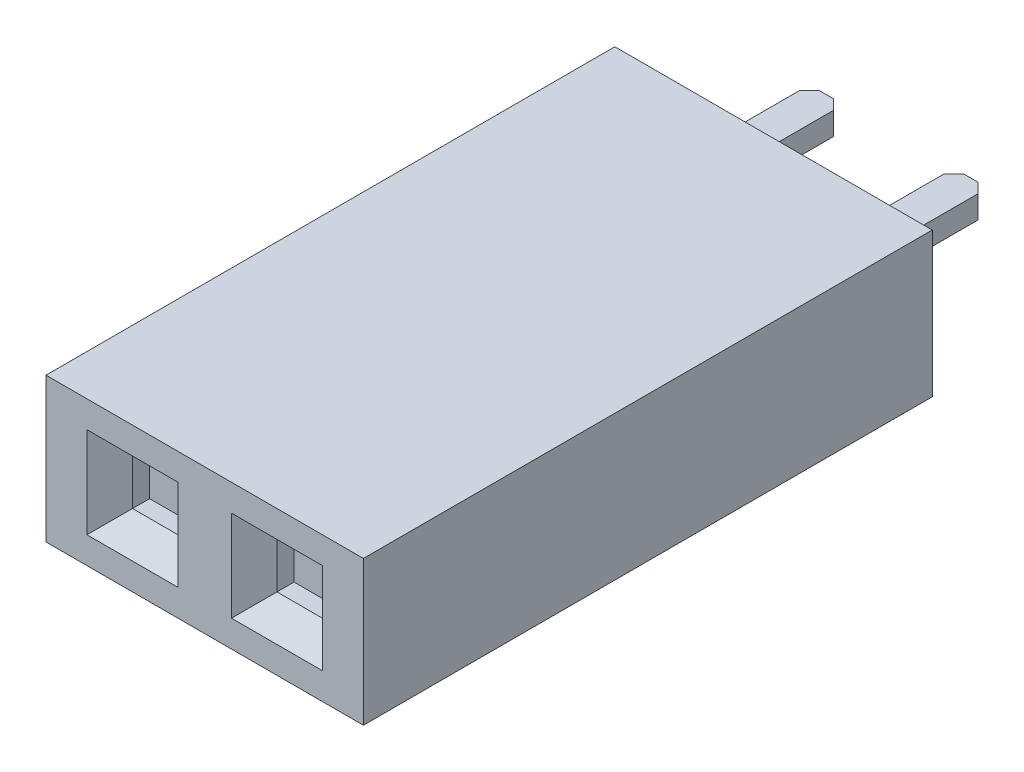
from build123d import *

# Parameters (mm, degrees)
SKETCH1_W           = 2.54
SKETCH1_H           = 10
BOSS_EXTRUDE1_DEPTH = 1.52
SKETCH2_W           = 0.8
SKETCH2_H           = 0.8
CUT_EXTRUDE1_DEPTH  = 0.7
CHAMFER_1_SIZE      = 0.4
BOSS_EXTRUDE2_DEPTH = 0.2
LPATTERN1_COUNT     = 2
LPATTERN1_PITCH     = 2.54


with BuildPart() as part:
    # Sketch1 → Boss-Extrude1 (new, symmetric)
    with BuildSketch(Plane(origin=(0, 0, 0), x_dir=(0, -1, 0), z_dir=(1, 0, 0))):
        with Locations((0, -5)):
            Rectangle(SKETCH1_W, SKETCH1_H)
    extrude(amount=BOSS_EXTRUDE1_DEPTH, both=True)

    # Sketch2 → Cut-Extrude1 (cut)
    with BuildSketch(Plane(origin=(0, 0, 10), x_dir=(-1, 0, 0), z_dir=(0, 0, 1))):
        Rectangle(SKETCH2_W, SKETCH2_H)
    extrude(amount=-CUT_EXTRUDE1_DEPTH, mode=Mode.SUBTRACT)

    # Фаска1
    chamfer_1_edges = [part.edges().sort_by_distance(p)[0] for p in [
        (-0.4, 0, 10),
        (0, -0.4, 10),
        (0.4, 0, 10),
        (0, 0.4, 10),
    ]]
    chamfer(chamfer_1_edges, length=CHAMFER_1_SIZE)

    # Sketch3 → Boss-Extrude2 (add, symmetric)
    with BuildSketch(Plane(origin=(0, 0, 0), x_dir=(1, 0, 0), z_dir=(0, 1, 0))):
        Polygon((-0.3, 0), (-0.3, 2.024264069), (-0.124264069, 2.2), (0.124264069, 2.2), (0.3, 2.024264069), (0.3, 0), align=None)
    extrude(amount=BOSS_EXTRUDE2_DEPTH, both=True)


with BuildPart() as lpattern1_1:
    # LPattern1: pattern copy
    add(part.part.moved(Location(Vector(1, 0, 0) * (1 * LPATTERN1_PITCH))))


with BuildPart() as part_1:
    add(part.part)

    # Combine 1: union LPattern1_1
    add(lpattern1_1.part)


solid = part_1.part
